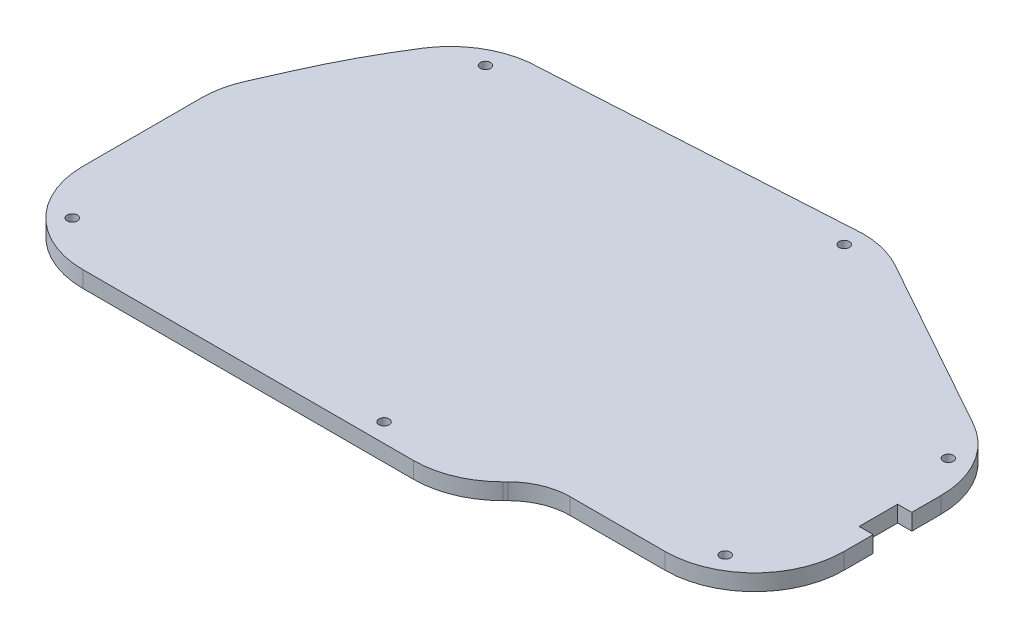
from build123d import *

# Parameters (mm, degrees)
SKETCH2_R           = 1
BOSS_EXTRUDE1_DEPTH = 3.175


with BuildPart() as part:
    # Sketch2 → Boss-Extrude1 (new body)
    with BuildSketch(Plane(origin=(0, 0, 0), x_dir=(1, 0, 0), z_dir=(0, 1, 0))):
        with BuildLine():
            Line((-145.18277075, -44.880968233), (-179.497120097, -25.768390824))
            ThreePointArc((-179.497120097, -25.768390824), (-183.588653035, -24.128556812), (-187.960968922, -23.569494069))
            Line((-187.960968922, -23.569494069), (-247.377604545, -27.068041697))
            ThreePointArc((-247.377604545, -27.068041697), (-255.760524502, -29.218913898), (-262.07032604, -35.142257782))
            ThreePointArc((-262.07032604, -35.142257782), (-266.807761783, -43.251676507), (-270.933745897, -51.688632391))
            Line((-270.933745897, -51.688632391), (-273.728235609, -57.981701498))
            ThreePointArc((-273.728235609, -57.981701498), (-274.847170355, -61.434035543), (-275.2256366, -65.043382939))
            Line((-275.2256366, -65.043382939), (-275.2256366, -88.130010281))
            ThreePointArc((-275.2256366, -88.130010281), (-270.129294593, -100.433668273), (-257.8256366, -105.530010281))
            Line((-257.8256366, -105.530010281), (-193.494425739, -105.530010281))
            ThreePointArc((-193.494425739, -105.530010281), (-186.835734016, -104.205514146), (-181.190767747, -100.433668273))
            Line((-181.190767747, -100.433668273), (-180.680815133, -99.923715659))
            ThreePointArc((-180.680815133, -99.923715659), (-176.755292612, -97.300765368), (-172.12482308, -96.379707712))
            Line((-172.12482308, -96.379707712), (-153.649556898, -96.379707712))
            ThreePointArc((-153.649556898, -96.379707712), (-141.345898905, -91.283365704), (-136.249556898, -78.979707712))
            Line((-136.249556898, -78.979707712), (-136.249556898, -73.280889471))
            Line((-136.249556898, -73.280889471), (-138.999556898, -73.280889471))
            Line((-138.999556898, -73.280889471), (-138.999556898, -65.780889471))
            Line((-138.999556898, -65.780889471), (-136.249556898, -65.780889471))
            Line((-136.249556898, -65.780889471), (-136.249556898, -60.08207123))
            ThreePointArc((-136.249556898, -60.08207123), (-138.648188978, -51.266235449), (-145.18277075, -44.880968233))
        make_face()
        with Locations((-147.207602145, -91.127288498)):
            Circle(SKETCH2_R, mode=Mode.SUBTRACT)
        with Locations((-141.795027651, -53.115534334)):
            Circle(SKETCH2_R, mode=Mode.SUBTRACT)
        with Locations((-187.963906245, -27.219493821)):
            Circle(SKETCH2_R, mode=Mode.SUBTRACT)
        with Locations((-253.051529835, -31.941972813)):
            Circle(SKETCH2_R, mode=Mode.SUBTRACT)
        with Locations((-267.548354841, -97.852728522)):
            Circle(SKETCH2_R, mode=Mode.SUBTRACT)
        with Locations((-202.85468144, -101.880010281)):
            Circle(SKETCH2_R, mode=Mode.SUBTRACT)
    extrude(amount=BOSS_EXTRUDE1_DEPTH)


solid = part.part
